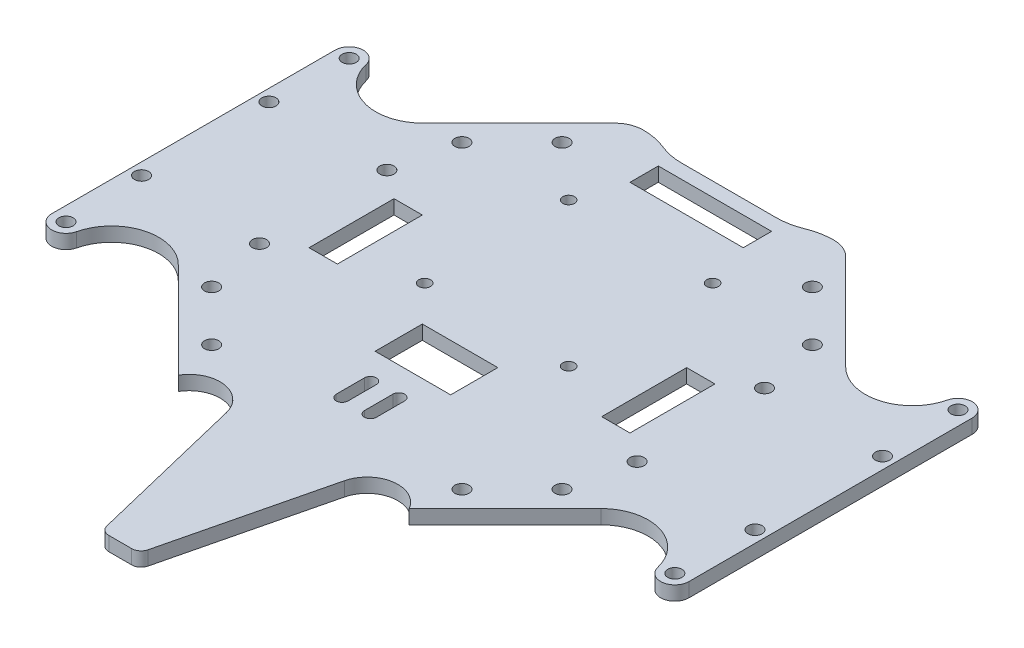
from build123d import *

# Parameters (mm, degrees)
SKETCH_1_R          = 1.5
EXTRUDE_1_DEPTH     = 3
SKETCH_2_R          = 1.5
SKETCH_2_R_2        = 1.25
SKETCH_2_W          = 16
SKETCH_2_H          = 10
CUT_EXTRUDE_1_DEPTH = 31
SKETCH_3_W          = 24
SKETCH_3_H          = 6
SKETCH_3_W_2        = 6
SKETCH_3_H_2        = 18
CUT_EXTRUDE_2_DEPTH = 10
SKETCH_5_R          = 1.5
CUT_EXTRUDE_3_DEPTH = 10
CUT_EXTRUDE_4_DEPTH = 3


with BuildPart() as part:
    # 草图1 → 凸台-拉伸1 (new body)
    with BuildSketch(Plane(origin=(0, 0, 0), x_dir=(1, 0, 0), z_dir=(0, 1, 0))):
        with BuildLine():
            Line((-12.5, -50), (-12.5, -81))
            ThreePointArc((-12.5, -81), (-11.914213562, -82.414213562), (-10.5, -83))
            Line((-10.5, -83), (10.5, -83))
            ThreePointArc((10.5, -83), (11.914213562, -82.414213562), (12.5, -81))
            Line((12.5, -81), (12.5, -50))
            ThreePointArc((12.5, -50), (13.085786438, -48.585786438), (14.5, -48))
            Line((14.5, -48), (67.5, -48))
            Line((67.5, -48), (67.5, 48))
            Line((67.5, 48), (-67.5, 48))
            Line((-67.5, 48), (-67.5, -48))
            Line((-67.5, -48), (-14.5, -48))
            ThreePointArc((-14.5, -48), (-13.085786438, -48.585786438), (-12.5, -50))
        make_face()
        with Locations((-37.123106012, 26.516504294)):
            Circle(SKETCH_1_R, mode=Mode.SUBTRACT)
        with Locations((-26.516504294, 37.123106012)):
            Circle(SKETCH_1_R, mode=Mode.SUBTRACT)
        with Locations((26.516504294, 37.123106012)):
            Circle(SKETCH_1_R, mode=Mode.SUBTRACT)
        with Locations((37.123106012, 26.516504294)):
            Circle(SKETCH_1_R, mode=Mode.SUBTRACT)
        with Locations((37.123106012, -26.516504294)):
            Circle(SKETCH_1_R, mode=Mode.SUBTRACT)
        with Locations((26.516504294, -37.123106012)):
            Circle(SKETCH_1_R, mode=Mode.SUBTRACT)
        with Locations((-37.123106012, -26.516504294)):
            Circle(SKETCH_1_R, mode=Mode.SUBTRACT)
        with Locations((-26.516504294, -37.123106012)):
            Circle(SKETCH_1_R, mode=Mode.SUBTRACT)
    extrude(amount=EXTRUDE_1_DEPTH)

    # 草图2 → 切除-拉伸1 (cut)
    with BuildSketch(Plane(origin=(0, 3, 0), x_dir=(1, 0, 0), z_dir=(0, 1, 0))):
        with Locations((-40, 13.5)):
            Circle(SKETCH_2_R)
        with Locations((-40, -13.5)):
            Circle(SKETCH_2_R)
        with Locations((-65, 13.5)):
            Circle(SKETCH_2_R)
        with Locations((-65, -13.5)):
            Circle(SKETCH_2_R)
        with Locations((40, -13.5)):
            Circle(SKETCH_2_R)
        with Locations((40, 13.5)):
            Circle(SKETCH_2_R)
        with Locations((65, -13.5)):
            Circle(SKETCH_2_R)
        with Locations((65, 13.5)):
            Circle(SKETCH_2_R)
        with Locations((-15.25, 27.25)):
            Circle(SKETCH_2_R_2)
        with Locations((15.25, 27.25)):
            Circle(SKETCH_2_R_2)
        with Locations((15.25, -3.25)):
            Circle(SKETCH_2_R_2)
        with Locations((-15.25, -3.25)):
            Circle(SKETCH_2_R_2)
        with BuildLine():
            Line((4.25, -33), (4.25, -27))
            ThreePointArc((4.25, -27), (3, -25.75), (1.75, -27))
            Line((1.75, -27), (1.75, -33))
            ThreePointArc((1.75, -33), (3, -34.25), (4.25, -33))
        make_face()
        with BuildLine():
            Line((-4.25, -33), (-4.25, -27))
            ThreePointArc((-4.25, -27), (-3, -25.75), (-1.75, -27))
            Line((-1.75, -27), (-1.75, -33))
            ThreePointArc((-1.75, -33), (-3, -34.25), (-4.25, -33))
        make_face()
        with Locations((0, -16)):
            Rectangle(SKETCH_2_W, SKETCH_2_H)
    extrude(amount=-CUT_EXTRUDE_1_DEPTH, mode=Mode.SUBTRACT)

    # 草图3 → 切除-拉伸2 (cut)
    with BuildSketch(Plane(origin=(0, 3, 0), x_dir=(1, 0, 0), z_dir=(0, 1, 0))):
        with Locations((0, 40)):
            Rectangle(SKETCH_3_W, SKETCH_3_H)
        with Locations((31, 0)):
            Rectangle(SKETCH_3_W_2, SKETCH_3_H_2)
        with Locations((-31, 0)):
            Rectangle(SKETCH_3_W_2, SKETCH_3_H_2)
    extrude(amount=-CUT_EXTRUDE_2_DEPTH, mode=Mode.SUBTRACT)

    # 草图5 → 切除-拉伸3 (cut)
    with BuildSketch(Plane(origin=(0, 3, 0), x_dir=(1, 0, 0), z_dir=(0, 1, 0))):
        with Locations((-64.5, 30)):
            Circle(SKETCH_5_R)
        with Locations((64.5, 30)):
            Circle(SKETCH_5_R)
        with Locations((64.5, -30)):
            Circle(SKETCH_5_R)
        with Locations((-64.5, -30)):
            Circle(SKETCH_5_R)
        with BuildLine():
            Line((-24.468037432, 46.242640687), (-44.780190541, 25.930487577))
            ThreePointArc((-44.780190541, 25.930487577), (-54.578308632, 23.380578475), (-61.58105962, 30.692666628))
            ThreePointArc((-61.58105962, 30.692666628), (-64.848696759, 32.979666184), (-67.5, 30))
            Line((-67.5, 30), (-67.5, 48))
            Line((-67.5, 48), (-20.225396744, 48))
            ThreePointArc((-20.225396744, 48), (-22.521497339, 47.543277195), (-24.468037432, 46.242640687))
        make_face()
        with BuildLine():
            Line((67.5, 48), (67.5, 30))
            ThreePointArc((67.5, 30), (64.848696759, 32.979666184), (61.58105962, 30.692666628))
            ThreePointArc((61.58105962, 30.692666628), (54.578308632, 23.380578475), (44.780190541, 25.930487577))
            Line((44.780190541, 25.930487577), (24.468037432, 46.242640687))
            ThreePointArc((24.468037432, 46.242640687), (22.521497339, 47.543277195), (20.225396744, 48))
            Line((20.225396744, 48), (67.5, 48))
        make_face()
        with BuildLine():
            Line((67.5, -48), (67.5, -30))
            ThreePointArc((67.5, -30), (64.848696759, -32.979666184), (61.58105962, -30.692666628))
            ThreePointArc((61.58105962, -30.692666628), (54.578308632, -23.380578475), (44.780190541, -25.930487577))
            Line((44.780190541, -25.930487577), (24.468037432, -46.242640687))
            ThreePointArc((24.468037432, -46.242640687), (22.521497339, -47.543277195), (20.225396744, -48))
            Line((20.225396744, -48), (67.5, -48))
        make_face()
        with BuildLine():
            Line((-20.225396744, -48), (-67.5, -48))
            Line((-67.5, -48), (-67.5, -30))
            ThreePointArc((-67.5, -30), (-64.848696759, -32.979666184), (-61.58105962, -30.692666628))
            ThreePointArc((-61.58105962, -30.692666628), (-54.578308632, -23.380578475), (-44.780190541, -25.930487577))
            Line((-44.780190541, -25.930487577), (-24.468037432, -46.242640687))
            ThreePointArc((-24.468037432, -46.242640687), (-22.521497339, -47.543277195), (-20.225396744, -48))
        make_face()
    extrude(amount=-CUT_EXTRUDE_3_DEPTH, mode=Mode.SUBTRACT)

    # 草图6 → 切除-拉伸4 (cut)
    with BuildSketch(Plane(origin=(0, 3, 0), x_dir=(1, 0, 0), z_dir=(0, 1, 0))):
        with BuildLine():
            Line((-10, 46), (10, 46))
            ThreePointArc((10, 46), (12.547371205, 46.246783902), (15, 46.977957164))
            ThreePointArc((15, 46.977957164), (17.563191705, 47.742091241), (20.225396744, 48))
            Line((20.225396744, 48), (20.225396744, 49))
            Line((20.225396744, 49), (-20.225396744, 49))
            Line((-20.225396744, 49), (-20.225396744, 48))
            ThreePointArc((-20.225396744, 48), (-17.563191705, 47.742091241), (-15, 46.977957164))
            ThreePointArc((-15, 46.977957164), (-12.547371205, 46.246783902), (-10, 46))
        make_face()
        with BuildLine():
            Line((-4.371087012, -81.471994656), (-12.5, -48))
            ThreePointArc((-12.5, -48), (-17.891385365, -43.085345419), (-24.468037432, -46.242640687))
            Line((-24.468037432, -46.242640687), (-24.468037432, -84))
            Line((-24.468037432, -84), (24.468037432, -84))
            Line((24.468037432, -84), (24.468037432, -46.242640687))
            ThreePointArc((24.468037432, -46.242640687), (17.891385365, -43.085345419), (12.5, -48))
            Line((12.5, -48), (4.371087012, -81.471994656))
            ThreePointArc((4.371087012, -81.471994656), (3.663704737, -82.572257821), (2.427579604, -83))
            Line((2.427579604, -83), (-2.427579604, -83))
            ThreePointArc((-2.427579604, -83), (-3.663704737, -82.572257821), (-4.371087012, -81.471994656))
        make_face()
    extrude(amount=-CUT_EXTRUDE_4_DEPTH, mode=Mode.SUBTRACT)


solid = part.part
